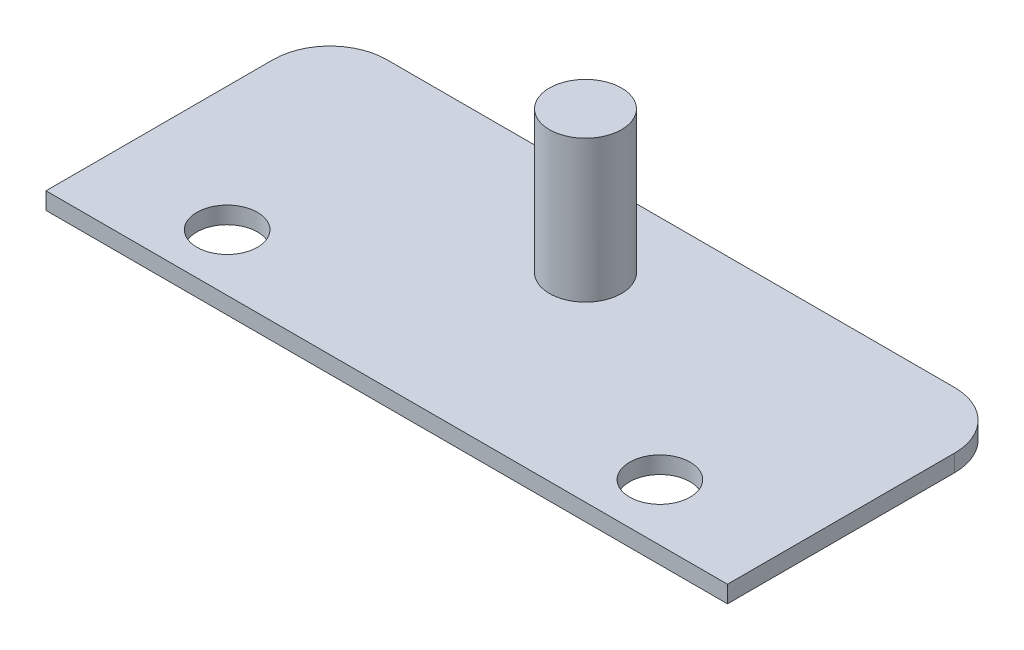
from build123d import *

# Parameters (mm, degrees)
SKETCH1_W           = 120
SKETCH1_H           = 50
BOSS_EXTRUDE1_DEPTH = 3
SKETCH2_R           = 5.334
CUT_EXTRUDE1_DEPTH  = 131.034610777
SKETCH3_R           = 6.35
BOSS_EXTRUDE2_DEPTH = 25
FILLET1_R           = 10


with BuildPart() as part:
    # Sketch1 → Boss-Extrude1 (new body)
    with BuildSketch(Plane(origin=(0, 0, 0), x_dir=(1, 0, 0), z_dir=(0, 1, 0))):
        with Locations((60, 25)):
            Rectangle(SKETCH1_W, SKETCH1_H)
    extrude(amount=BOSS_EXTRUDE1_DEPTH)

    # Sketch2 → Cut-Extrude1 (cut, through all)
    with BuildSketch(Plane(origin=(0, 3, 0), x_dir=(1, 0, 0), z_dir=(0, 1, 0))):
        with Locations((21.9, 10)):
            Circle(SKETCH2_R)
        with Locations((98.1, 10)):
            Circle(SKETCH2_R)
    extrude(amount=-CUT_EXTRUDE1_DEPTH, mode=Mode.SUBTRACT)

    # Sketch3 → Boss-Extrude2 (add)
    with BuildSketch(Plane(origin=(0, 3, 0), x_dir=(1, 0, 0), z_dir=(0, 1, 0))):
        with Locations((60, 35)):
            Circle(SKETCH3_R)
    extrude(amount=BOSS_EXTRUDE2_DEPTH)

    # Fillet1
    fillet1_edges = [part.edges().sort_by_distance(p)[0] for p in [
        (120, 1.5, -50),
        (0, 1.5, -50),
    ]]
    fillet(fillet1_edges, radius=FILLET1_R)


solid = part.part
